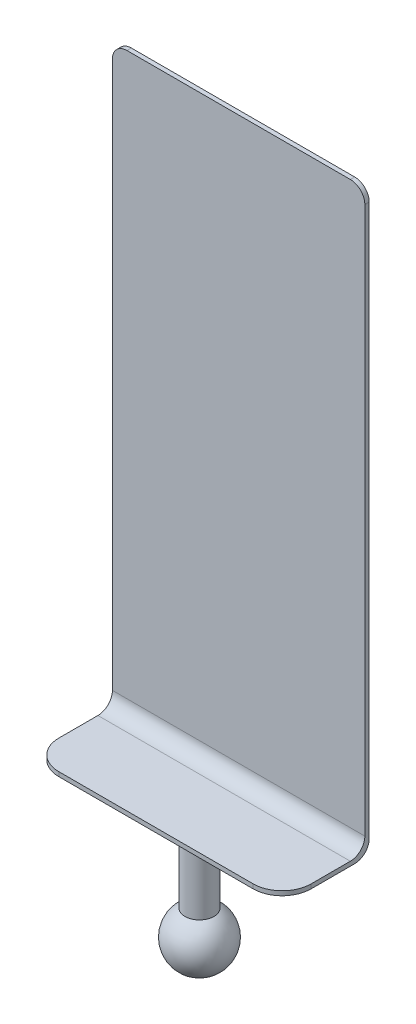
from build123d import *

# Parameters (mm, degrees)
SKETCH1_W           = 87
SKETCH1_H           = 1.5
BOSS_EXTRUDE1_DEPTH = 200
SKETCH2_W           = 87
SKETCH2_H           = 1.5
BOSS_EXTRUDE2_DEPTH = 28.5
FILLET1_R           = 5
FILLET2_R           = 5
FILLET3_R           = 5
FILLET4_R           = 10


with BuildPart() as part:
    # Sketch1 → Boss-Extrude1 (new body)
    with BuildSketch(Plane(origin=(0, 0, 0), x_dir=(1, 0, 0), z_dir=(0, 1, 0))):
        Rectangle(SKETCH1_W, SKETCH1_H)
    extrude(amount=BOSS_EXTRUDE1_DEPTH)

    # Sketch2 → Boss-Extrude2 (add)
    with BuildSketch(Plane.XY.offset(0.75)):
        with Locations((0, 0.75)):
            Rectangle(SKETCH2_W, SKETCH2_H)
    extrude(amount=BOSS_EXTRUDE2_DEPTH)

    # Fillet1
    fillet1_edges = [part.edges().sort_by_distance(p)[0] for p in [
        (0, 1.5, 0.75),
        (0, 0, -0.75),
    ]]
    fillet(fillet1_edges, radius=FILLET1_R)

    # Sketch4 → Revolve1 (revolve)
    with BuildSketch(Plane.XY.offset(14.25), mode=Mode.PRIVATE) as revolve1_sk:
        with BuildLine():
            Line((5, 0), (5, -30))
            ThreePointArc((5, -30), (9.659258263, -41.248444489), (0, -48.660254038))
            Line((0, -48.660254038), (0, 0))
            Line((0, 0), (0, 0.59177988))
            Line((0, 0.59177988), (5, 0.59177988))
            Line((5, 0.59177988), (5, 0))
        make_face()
    revolve(revolve1_sk.sketch.rotate(Axis((0, 0, 14.25), (0, -1, 0)), 180), axis=Axis((0, 0, 14.25), (0, -1, 0)))

    # Fillet2
    fillet2_edges = [part.edges().sort_by_distance(p)[0] for p in [
        (5, 0, 14.25),
    ]]
    fillet(fillet2_edges, radius=FILLET2_R - 0.0001)  # a hair under: the kernel refuses the full size

    # Fillet3
    fillet3_edges = [part.edges().sort_by_distance(p)[0] for p in [
        (43.5, 200, 0),
        (-43.5, 200, 0),
    ]]
    fillet(fillet3_edges, radius=FILLET3_R)

    # Fillet4
    fillet4_edges = [part.edges().sort_by_distance(p)[0] for p in [
        (-43.5, 0.75, 29.25),
        (43.5, 0.75, 29.25),
    ]]
    fillet(fillet4_edges, radius=FILLET4_R)


solid = part.part
